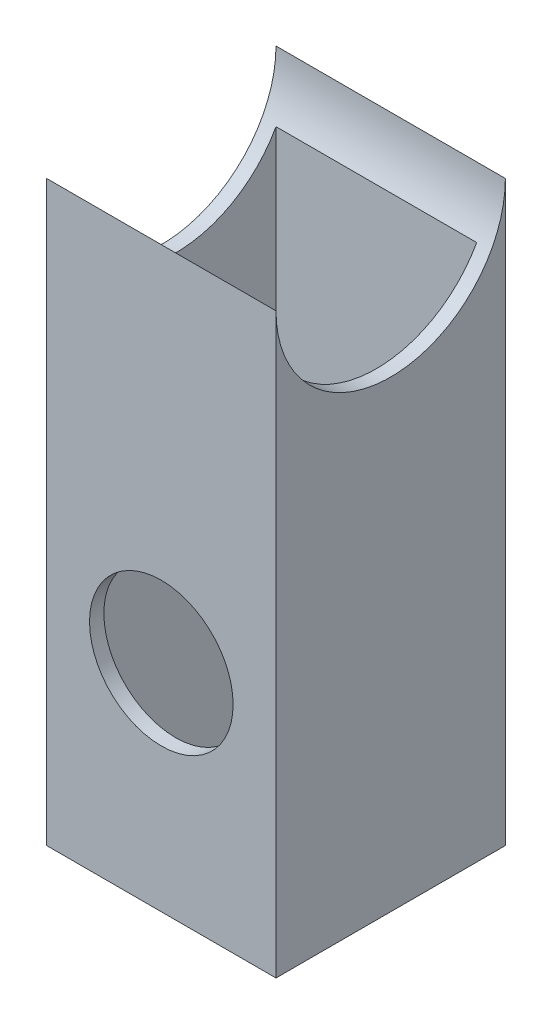
from build123d import *

# Parameters (mm, degrees)
SKETCH1_W               = 25.4
SKETCH1_H               = 25.4
SKETCH1_W_2             = 22.225
SKETCH1_H_2             = 22.225
BOSS_EXTRUDE1_DEPTH     = 63.9826
CUT_EXTRUDE1_DEPTH      = 71.001593573
CUT_EXTRUDE1_DEPTH_BACK = 71.001593573
SKETCH2_R               = 7.9502
SKETCH3_R               = 12.7
CUT_EXTRUDE2_DEPTH      = 71.001593573


with BuildPart() as part:
    # Sketch1 → Boss-Extrude1 (new body)
    with BuildSketch(Plane(origin=(0, 0, 0), x_dir=(1, 0, 0), z_dir=(0, 1, 0))):
        Rectangle(SKETCH1_W, SKETCH1_H)
        Rectangle(SKETCH1_W_2, SKETCH1_H_2, mode=Mode.SUBTRACT)
    extrude(amount=BOSS_EXTRUDE1_DEPTH)

    # Sketch2 → Cut-Extrude1 (cut, two sides: drawn at the far end of the back side and taken through both)
    with BuildSketch(Plane.XY.offset(12.7).offset(-CUT_EXTRUDE1_DEPTH_BACK)):
        with Locations((0, 23.8506)):
            Circle(SKETCH2_R)
    extrude(amount=CUT_EXTRUDE1_DEPTH + CUT_EXTRUDE1_DEPTH_BACK, mode=Mode.SUBTRACT)

    # Sketch3 → Cut-Extrude2 (cut, through all)
    with BuildSketch(Plane(origin=(12.7, 0, 0), x_dir=(0, 0, -1), z_dir=(1, 0, 0))):
        with Locations((0, 63.9826)):
            Circle(SKETCH3_R)
    extrude(amount=-CUT_EXTRUDE2_DEPTH, mode=Mode.SUBTRACT)


solid = part.part
